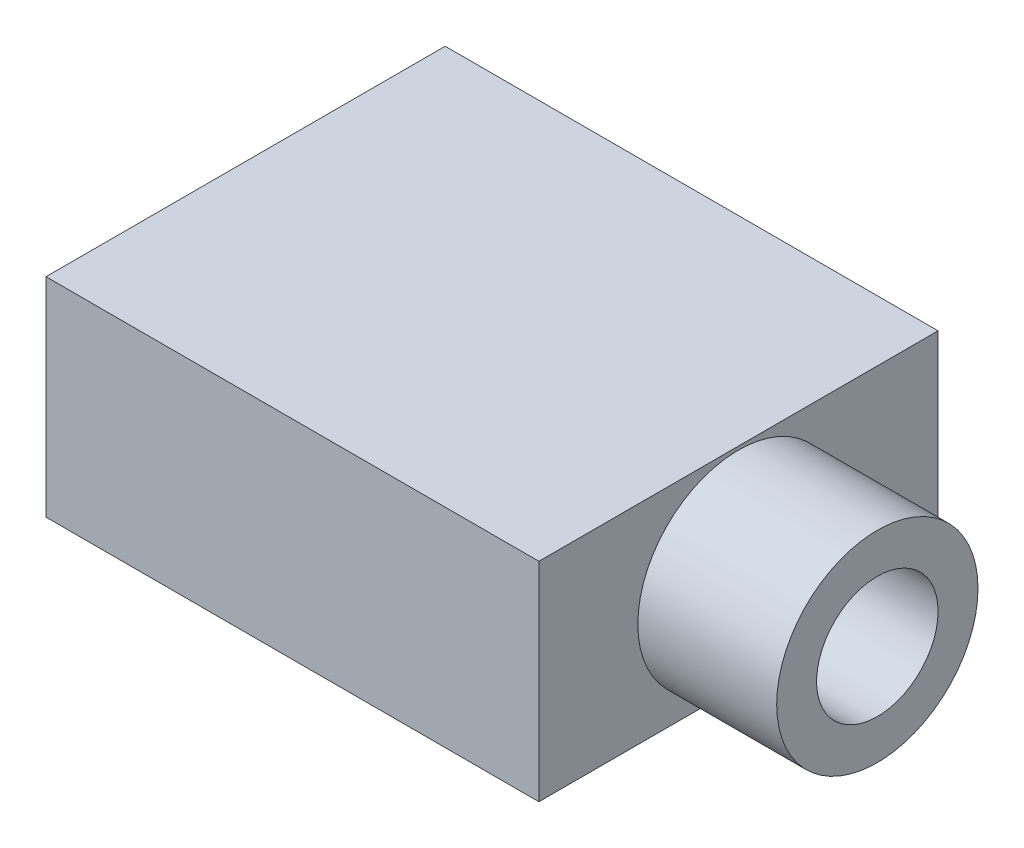
from build123d import *

# Parameters (mm, degrees)
SKETCH1_W           = 14.2
SKETCH1_H           = 11.5
BOSS_EXTRUDE1_DEPTH = 6
SKETCH2_R           = 2.9
BOSS_EXTRUDE2_DEPTH = 4
SKETCH3_R           = 1.75
CUT_EXTRUDE1_DEPTH  = 15


with BuildPart() as part:
    # Sketch1 → Boss-Extrude1 (new body)
    with BuildSketch(Plane(origin=(0, 0, 0), x_dir=(1, 0, 0), z_dir=(0, 1, 0))):
        with Locations((-58.404587156, 38.561926606)):
            Rectangle(SKETCH1_W, SKETCH1_H)
    extrude(amount=BOSS_EXTRUDE1_DEPTH)

    # Sketch2 → Boss-Extrude2 (add)
    with BuildSketch(Plane(origin=(-51.304587156, 0, 0), x_dir=(0, 0, -1), z_dir=(1, 0, 0))):
        with Locations((38.561926606, 3)):
            Circle(SKETCH2_R)
    extrude(amount=BOSS_EXTRUDE2_DEPTH)

    # Sketch3 → Cut-Extrude1 (cut)
    with BuildSketch(Plane(origin=(-47.304587156, 0, 0), x_dir=(0, 0, -1), z_dir=(1, 0, 0))):
        with Locations((38.561926606, 3)):
            Circle(SKETCH3_R)
    extrude(amount=-CUT_EXTRUDE1_DEPTH, mode=Mode.SUBTRACT)


solid = part.part
